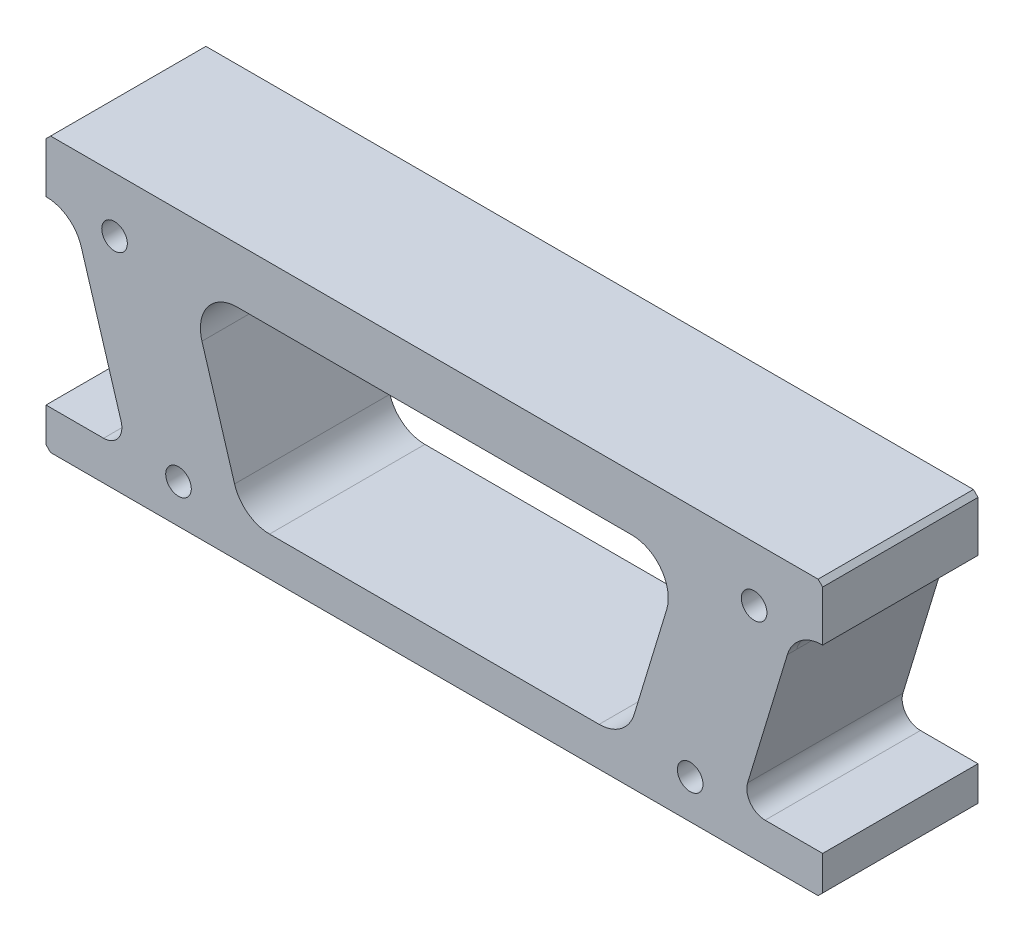
from build123d import *
from build123d.topology import SkipClean

# Parameters (mm, degrees)
SKETCH_1_W           = 85
SKETCH_1_H           = 15
EXTRUDE_1_DEPTH      = 30
SKETCH_2_R           = 1.4
CUT_EXTRUDE_1_DEPTH  = 40
CUT_EXTRUDE_2_DEPTH  = 40
FILLET_1_R           = 4
SKETCH_5_R           = 1.8
CUT_EXTRUDE_3_DEPTH  = 5
CHAMFER_1_SIZE       = 0.5
CUT_EXTRUDE_4_DEPTH  = 24
FILLET_3_R           = 4
CUT_EXTRUDE_START    = -5
SKETCH_9_R           = 1.8
CUT_EXTRUDE_5_DEPTH  = 5
FILLET_4_R           = 2
EXTRUDE_3_DEPTH      = 1
EXTRUDE_3_DEPTH_BACK = 16
SKETCH_10_R          = 1.4
FILLET_START         = -8.5
FILLET_5_DEPTH       = 17


with BuildPart() as part:
    # 草图1 → 凸台-拉伸1 (new body)
    with BuildSketch(Plane(origin=(0, 0, 0), x_dir=(1, 0, 0), z_dir=(0, 1, 0))):
        Rectangle(SKETCH_1_W, SKETCH_1_H)
    extrude(amount=EXTRUDE_1_DEPTH)

    # 草图2 → 切除-拉伸1 (cut)
    with BuildSketch(Plane.XY.offset(7.5)):
        with Locations((-35, 24)):
            Circle(SKETCH_2_R)
        with Locations((35, 24)):
            Circle(SKETCH_2_R)
        with Locations((28, 4.255699158)):
            Circle(SKETCH_2_R)
        with Locations((-28, 4.255699158)):
            Circle(SKETCH_2_R)
    extrude(amount=-CUT_EXTRUDE_1_DEPTH, mode=Mode.SUBTRACT)

    # 草图3 → 切除-拉伸2 (cut)
    with BuildSketch(Plane.XY.offset(7.5)):
        Polygon((-27, 24), (27, 24), (21, 4.255699158), (-21, 4.255699158), align=None)
    extrude(amount=-CUT_EXTRUDE_2_DEPTH, mode=Mode.SUBTRACT)

    # 圆角1
    fillet_1_edges = [part.edges().sort_by_distance(p)[0] for p in [
        (-21, 4.255699158, 0),
        (-27, 24, 0),
        (27, 24, 0),
        (21, 4.255699158, 0),
    ]]
    fillet(fillet_1_edges, radius=FILLET_1_R)

    # 草图5 → 切除-拉伸3 (cut)
    with BuildSketch(Plane(origin=(0, 30, 0), x_dir=(1, 0, 0), z_dir=(0, 1, 0))):
        with Locations(Location((-35, 4.5, 0), (0, 0, 270))):
            Circle(SKETCH_5_R)
        with Locations(Location((35, 4.5, 0), (0, 0, 270))):
            Circle(SKETCH_5_R)
        with Locations(Location((-20, -4.5, 0), (0, 0, 270))):
            Circle(SKETCH_5_R)
        with Locations(Location((20, -4.5, 0), (0, 0, 270))):
            Circle(SKETCH_5_R)
    extrude(amount=-CUT_EXTRUDE_3_DEPTH, mode=Mode.SUBTRACT)

    # 倒角1
    chamfer_1_edges = [part.edges().sort_by_distance(p)[0] for p in [
        (-42.5, 30, 0),
        (42.5, 30, 0),
        (-42.5, 0, 0),
        (42.5, 0, 0),
    ]]
    chamfer(chamfer_1_edges, length=CHAMFER_1_SIZE)

    # 草图6 → 切除-拉伸4 (cut)
    with BuildSketch(Plane.XY.offset(7.5)):
        Polygon((-42.5, 24), (-39.5, 24), (-33.5, 4.255699158), (-42.5, 4.255699158), align=None)
        Polygon((42.5, 24), (42.5, 4.255699158), (33.5, 4.255699158), (39.5, 24), align=None)
    extrude(amount=-CUT_EXTRUDE_4_DEPTH, mode=Mode.SUBTRACT)

    # 圆角3
    fillet_3_edges = [part.edges().sort_by_distance(p)[0] for p in [
        (-39.5, 24, 0),
        (39.5, 24, 0),
    ]]
    fillet(fillet_3_edges, radius=FILLET_3_R)

    # 草图9 → 切除-拉伸5 (cut)
    with BuildSketch(Plane.XZ.offset(CUT_EXTRUDE_START)):
        with Locations(Location((20, 4.5, 0), (0, 0, 90))):
            Circle(SKETCH_9_R)
        with Locations(Location((-20, 4.5, 0), (0, 0, 90))):
            Circle(SKETCH_9_R)
        with Locations(Location((-35, -4.5, 0), (0, 0, 90))):
            Circle(SKETCH_9_R)
        with Locations(Location((35, -4.5, 0), (0, 0, 90))):
            Circle(SKETCH_9_R)
    extrude(amount=CUT_EXTRUDE_5_DEPTH, mode=Mode.SUBTRACT)

    # 圆角4
    # the kernel refuses this fillet: 2 mm, written as the material it adds along each edge
    with BuildSketch(Plane(origin=(-33.5, 4.255699158, 7.5), x_dir=(-1, 0, 0), z_dir=(0, 0, -1))) as fillet_4_piece_1_section:
        with BuildLine():
            CenterArc((FILLET_4_R * 1.34903882702, FILLET_4_R), FILLET_4_R, 163.096751643, 106.903248357)
            Line((FILLET_4_R * 0.392241725729, FILLET_4_R * 1.29075643923), (0, 0))
            Line((0, 0), (FILLET_4_R * 1.34903882702, 0))
        make_face()
    fillet_4_piece_1 = extrude(amount=17.750206698, mode=Mode.PRIVATE)
    fillet_4_piece_1 = split(fillet_4_piece_1, bisect_by=Plane(origin=(-33.5, 4.255699158, -7.5), z_dir=(0, 0, 1)), keep=Keep.TOP, mode=Mode.PRIVATE)
    fillet_4_piece_1 = fillet_4_piece_1 - Plane(origin=(-35, 4.255699158, -4.5), x_dir=(0, 0, 1), z_dir=(0, 1, 0)) * Cylinder(1.8, 47, mode=Mode.PRIVATE)
    add(fillet_4_piece_1)
    with BuildSketch(Plane(origin=(-33.5, 4.255699158, 7.5), x_dir=(-1, 0, 0), z_dir=(0, 0, -1))) as fillet_4_piece_2_section:
        with BuildLine():
            CenterArc((FILLET_4_R * 1.34903882702, FILLET_4_R), FILLET_4_R, 163.096751643, 106.903248357)
            Line((FILLET_4_R * 0.392241725729, FILLET_4_R * 1.29075643923), (0, 0))
            Line((0, 0), (FILLET_4_R * 1.34903882702, 0))
        make_face()
    fillet_4_piece_2 = extrude(amount=17.750206698, mode=Mode.PRIVATE)
    fillet_4_piece_2 = split(fillet_4_piece_2, bisect_by=Plane(origin=(-33.5, 4.255699158, -7.5), z_dir=(0, 0, 1)), keep=Keep.TOP, mode=Mode.PRIVATE)
    fillet_4_piece_2 = split(fillet_4_piece_2, bisect_by=Plane(origin=(-33.5, 5, 7.5), z_dir=(0, 1, 0)), keep=Keep.TOP, mode=Mode.PRIVATE)
    add(fillet_4_piece_2)
    with BuildSketch(Plane(origin=(33.5, 4.255699158, 7.5), x_dir=(0.2907564392301515, 0.9567971012948373, 0), z_dir=(0, 0, -1))) as fillet_4_piece_3_section:
        with BuildLine():
            CenterArc((FILLET_4_R * 1.34903882702, FILLET_4_R), FILLET_4_R, 163.096751643, 106.903248357)
            Line((FILLET_4_R * 0.392241725729, FILLET_4_R * 1.29075643923), (0, 0))
            Line((0, 0), (FILLET_4_R * 1.34903882702, 0))
        make_face()
    fillet_4_piece_3 = extrude(amount=17.750206698, mode=Mode.PRIVATE)
    fillet_4_piece_3 = split(fillet_4_piece_3, bisect_by=Plane(origin=(33.5, 4.255699158, -7.5), z_dir=(0, 0, 1)), keep=Keep.TOP, mode=Mode.PRIVATE)
    fillet_4_piece_3 = fillet_4_piece_3 - Plane(origin=(35, 4.255699158, -4.5), x_dir=(0, 0, 1), z_dir=(0, 1, 0)) * Cylinder(1.8, 47, mode=Mode.PRIVATE)
    add(fillet_4_piece_3)
    with BuildSketch(Plane(origin=(33.5, 4.255699158, 7.5), x_dir=(0.2907564392301515, 0.9567971012948373, 0), z_dir=(0, 0, -1))) as fillet_4_piece_4_section:
        with BuildLine():
            CenterArc((FILLET_4_R * 1.34903882702, FILLET_4_R), FILLET_4_R, 163.096751643, 106.903248357)
            Line((FILLET_4_R * 0.392241725729, FILLET_4_R * 1.29075643923), (0, 0))
            Line((0, 0), (FILLET_4_R * 1.34903882702, 0))
        make_face()
    fillet_4_piece_4 = extrude(amount=17.750206698, mode=Mode.PRIVATE)
    fillet_4_piece_4 = split(fillet_4_piece_4, bisect_by=Plane(origin=(33.5, 4.255699158, -7.5), z_dir=(0, 0, 1)), keep=Keep.TOP, mode=Mode.PRIVATE)
    fillet_4_piece_4 = split(fillet_4_piece_4, bisect_by=Plane(origin=(33.5, 5, 7.5), z_dir=(0, 1, 0)), keep=Keep.TOP, mode=Mode.PRIVATE)
    add(fillet_4_piece_4)

    # 草图10 → 凸台-拉伸3 (add, two sides: drawn at the far end of the back side and taken through both)
    with SkipClean():  # the faces are left unmerged after this step: merging them gives an invalid solid
        with BuildSketch(Plane(origin=(0, 0, -7.5), x_dir=(-1, 0, 0), z_dir=(0, 0, -1)).offset(-EXTRUDE_3_DEPTH_BACK)):
            with BuildLine():
                Line((42.5, 29.5), (42, 30))
                Line((42, 30), (-42, 30))
                Line((-42, 30), (-42.5, 29.5))
                Line((-42.5, 29.5), (-42.5, 24))
                Line((-42.5, 24), (-39.5, 24))
                Line((-39.5, 24), (-38.637885631, 21.163025757))
                Line((-38.637885631, 21.163025757), (-34.284483451, 6.837212037))
                ThreePointArc((-34.284483451, 6.837212037), (-34.591368944, 5.064696589), (-36.198077654, 4.255699158))
                Line((-36.198077654, 4.255699158), (-42.5, 4.255699158))
                Line((-42.5, 4.255699158), (-42.5, 0.5))
                Line((-42.5, 0.5), (-42, 0))
                Line((-42, 0), (42, 0))
                Line((42, 0), (42.5, 0.5))
                Line((42.5, 0.5), (42.5, 4.255699158))
                Line((42.5, 4.255699158), (36.198077654, 4.255699158))
                ThreePointArc((36.198077654, 4.255699158), (34.591368944, 5.064696589), (34.284483451, 6.837212037))
                Line((34.284483451, 6.837212037), (38.637885631, 21.163025757))
                Line((38.637885631, 21.163025757), (39.5, 24))
                Line((39.5, 24), (42.5, 24))
                Line((42.5, 24), (42.5, 29.5))
            make_face()
            with Locations((-28, 4.255699158)):
                Circle(SKETCH_10_R, mode=Mode.SUBTRACT)
            with Locations((28, 4.255699158)):
                Circle(SKETCH_10_R, mode=Mode.SUBTRACT)
            with BuildLine():
                Line((-21.603844692, 24), (21.603844692, 24))
                ThreePointArc((21.603844692, 24), (24.817262112, 22.38200514), (25.431033097, 18.836974243))
                Line((25.431033097, 18.836974243), (21.862114369, 7.092673402))
                ThreePointArc((21.862114369, 7.092673402), (20.416931104, 5.042281739), (18.034925964, 4.255699158))
                Line((18.034925964, 4.255699158), (-18.034925964, 4.255699158))
                ThreePointArc((-18.034925964, 4.255699158), (-20.416931104, 5.042281739), (-21.862114369, 7.092673402))
                Line((-21.862114369, 7.092673402), (-25.431033097, 18.836974243))
                ThreePointArc((-25.431033097, 18.836974243), (-24.817262112, 22.38200514), (-21.603844692, 24))
            make_face(mode=Mode.SUBTRACT)
            with Locations((-35, 24)):
                Circle(SKETCH_10_R, mode=Mode.SUBTRACT)
            with Locations((35, 24)):
                Circle(SKETCH_10_R, mode=Mode.SUBTRACT)
        extrude(amount=EXTRUDE_3_DEPTH + EXTRUDE_3_DEPTH_BACK)
    add(part.part.scale(1), mode=Mode.REPLACE)  # the faces are merged on a copy

    # 圆角5: read off the stored shape, not the designer's step
    # 圆角5 outline → 圆角5 (add)
    with BuildSketch(Plane.XY.offset(FILLET_START)):
        with BuildLine():
            ThreePointArc((-42.465074036, 24), (-40.083068896, 23.21341742), (-38.637885631, 21.163025757))
            Line((-38.637885631, 21.163025757), (-39.5, 24))
            Line((-39.5, 24), (-42.465074036, 24))
        make_face()
        with BuildLine():
            ThreePointArc((38.637885631, 21.163025757), (40.083068896, 23.21341742), (42.465074036, 24))
            Line((42.465074036, 24), (39.5, 24))
            Line((39.5, 24), (38.637885631, 21.163025757))
        make_face()
    extrude(amount=FILLET_5_DEPTH)


solid = part.part
